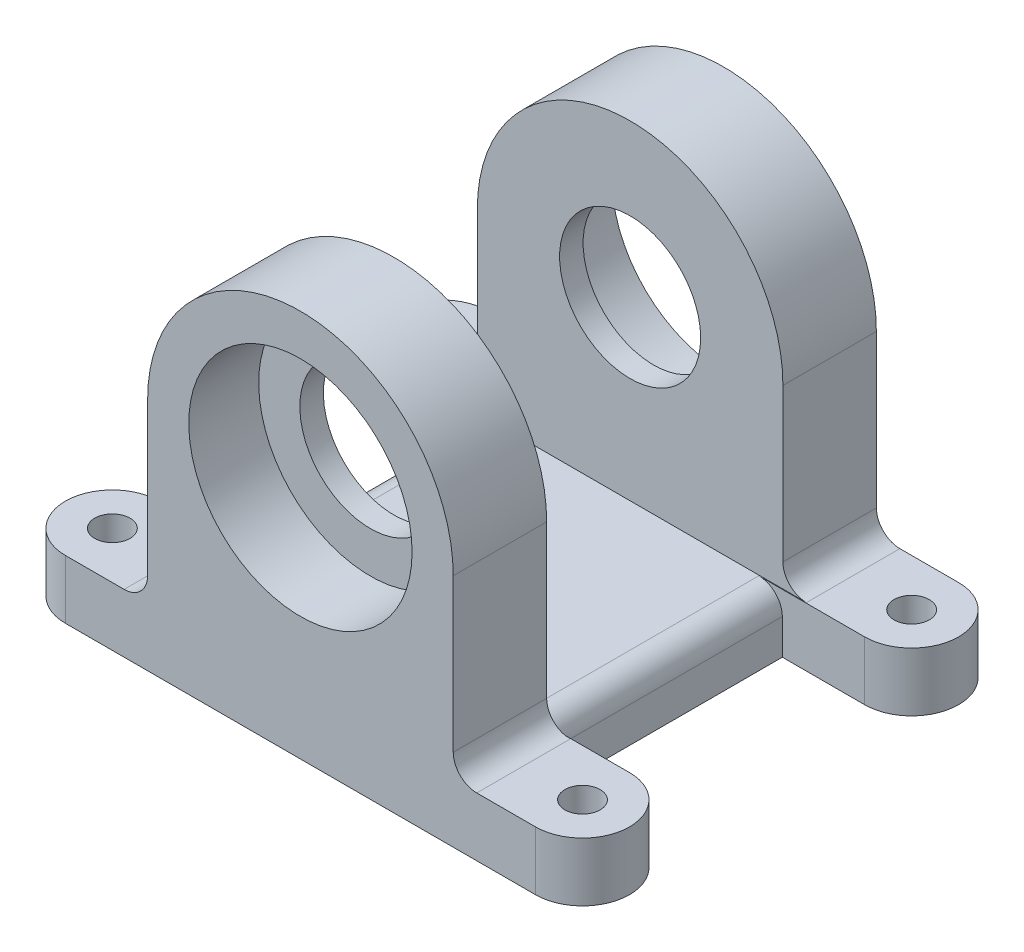
from build123d import *

# Parameters (mm, degrees)
CROQUIS1_R              = 9.5
SALIENTE_EXTRUIR1_DEPTH = 36
CROQUIS2_W              = 20.1
CROQUIS2_H              = 28
CORTAR_EXTRUIR2_DEPTH   = 49.703182648
CROQUIS3_R              = 9.5
CROQUIS3_R_2            = 6
SALIENTE_EXTRUIR2_DEPTH = 2
SALIENTE_EXTRUIR3_START = -2
CROQUIS4_R              = 9.5
CROQUIS4_R_2            = 6
SALIENTE_EXTRUIR3_DEPTH = 2
SALIENTE_EXTRUIR4_DEPTH = 5
CROQUIS6_R              = 1.5
CORTAR_EXTRUIR3_DEPTH   = 55.415071442
REDONDEO3_R             = 2


with BuildPart() as part:
    # Croquis1 → Saliente-Extruir1 (new body)
    with BuildSketch(Plane.XY):
        with BuildLine():
            Line((-13, 0), (-13, -20))
            Line((-13, -20), (13, -20))
            Line((13, -20), (13, 0))
            ThreePointArc((13, 0), (0, 13), (-13, 0))
        make_face()
        Circle(CROQUIS1_R, mode=Mode.SUBTRACT)
    extrude(amount=SALIENTE_EXTRUIR1_DEPTH)

    # Croquis2 → Cortar-Extruir2 (cut, through all)
    with BuildSketch(Plane(origin=(13, 0, 0), x_dir=(0, 0, -1), z_dir=(1, 0, 0))):
        with Locations((-18, -1)):
            Rectangle(CROQUIS2_W, CROQUIS2_H)
    extrude(amount=-CORTAR_EXTRUIR2_DEPTH, mode=Mode.SUBTRACT)

    # Croquis3 → Saliente-Extruir2 (add)
    with BuildSketch(Plane(origin=(0, 0, 28.05), x_dir=(-1, 0, 0), z_dir=(0, 0, -1))):
        Circle(CROQUIS3_R)
        Circle(CROQUIS3_R_2, mode=Mode.SUBTRACT)
    extrude(amount=-SALIENTE_EXTRUIR2_DEPTH)

    # Croquis4 → Saliente-Extruir3 (add)
    with BuildSketch(Plane.XY.offset(7.95).offset(SALIENTE_EXTRUIR3_START)):
        Circle(CROQUIS4_R)
        Circle(CROQUIS4_R_2, mode=Mode.SUBTRACT)
    extrude(amount=SALIENTE_EXTRUIR3_DEPTH)

    # Croquis5 → Saliente-Extruir4 (add)
    with BuildSketch(Plane.XZ.offset(20)):
        with BuildLine():
            Line((13, 36), (20, 36))
            ThreePointArc((20, 36), (24, 32), (20, 28))
            Line((20, 28), (13, 28))
            Line((13, 28), (13, 36))
        make_face()
        with BuildLine():
            Line((13, 0), (20, 0))
            ThreePointArc((20, 0), (24, 4), (20, 8))
            Line((20, 8), (13, 8))
            Line((13, 8), (13, 0))
        make_face()
        with BuildLine():
            Line((-13, 0), (-20, 0))
            ThreePointArc((-20, 0), (-24, 4), (-20, 8))
            Line((-20, 8), (-13, 8))
            Line((-13, 8), (-13, 0))
        make_face()
        with BuildLine():
            Line((-13, 28), (-13, 36))
            Line((-13, 36), (-20, 36))
            ThreePointArc((-20, 36), (-24, 32), (-20, 28))
            Line((-20, 28), (-13, 28))
        make_face()
    extrude(amount=-SALIENTE_EXTRUIR4_DEPTH)

    # Croquis6 → Cortar-Extruir3 (cut, through all)
    with BuildSketch(Plane.XZ.offset(20)):
        with Locations((-20, 32)):
            Circle(CROQUIS6_R)
        with Locations((20, 32)):
            Circle(CROQUIS6_R)
        with Locations((-20, 4)):
            Circle(CROQUIS6_R)
        with Locations((20, 4)):
            Circle(CROQUIS6_R)
    extrude(amount=-CORTAR_EXTRUIR3_DEPTH, mode=Mode.SUBTRACT)

    # Redondeo3
    redondeo3_edges = [part.edges().sort_by_distance(p)[0] for p in [
        (-13, -15, 32.025),
        (-13, -15, 3.975),
        (-13, -15, 18),
        (13, -15, 3.975),
        (13, -15, 18),
        (13, -15, 32.025),
    ]]
    fillet(redondeo3_edges, radius=REDONDEO3_R)


solid = part.part
